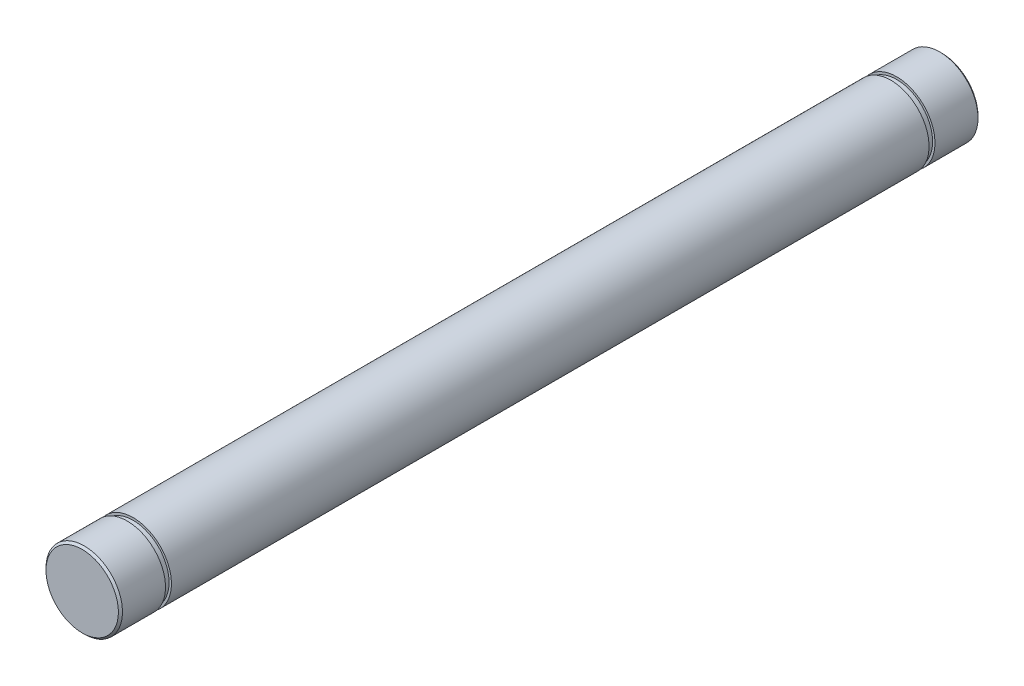
from build123d import *

# Parameters (mm, degrees)
SKETCH1_R           = 4.7625
BOSS_EXTRUDE1_DEPTH = 107.061
SKETCH2_R           = 5.514901598
SKETCH2_R_2         = 4.4704
CUT_EXTRUDE1_DEPTH  = 0.7366
CUT_EXTRUDE2_START  = 0.7366
SKETCH3_R           = 6.35
SKETCH3_R_2         = 4.4704
CUT_EXTRUDE2_DEPTH  = 0.7366
CHAMFER1_SIZE       = 0.254


with BuildPart() as part:
    # Sketch1 → Boss-Extrude1 (new body)
    with BuildSketch(Plane.XY):
        Circle(SKETCH1_R)
    extrude(amount=BOSS_EXTRUDE1_DEPTH)

    # Sketch2 → Cut-Extrude1 (cut)
    with BuildSketch(Plane.XY.offset(100.711)):
        Circle(SKETCH2_R)
        Circle(SKETCH2_R_2, mode=Mode.SUBTRACT)
    extrude(amount=CUT_EXTRUDE1_DEPTH, mode=Mode.SUBTRACT)

    # Sketch3 → Cut-Extrude2 (cut)
    with BuildSketch(Plane(origin=(0, 0, 6.35), x_dir=(-1, 0, 0), z_dir=(0, 0, -1)).offset(CUT_EXTRUDE2_START)):
        Circle(SKETCH3_R)
        Circle(SKETCH3_R_2, mode=Mode.SUBTRACT)
    extrude(amount=-CUT_EXTRUDE2_DEPTH, mode=Mode.SUBTRACT)

    # Chamfer1
    chamfer1_edges = [part.edges().sort_by_distance(p)[0] for p in [
        (-4.7625, 0, 107.061),
        (-4.7625, 0, 0),
    ]]
    chamfer(chamfer1_edges, length=CHAMFER1_SIZE)


solid = part.part
